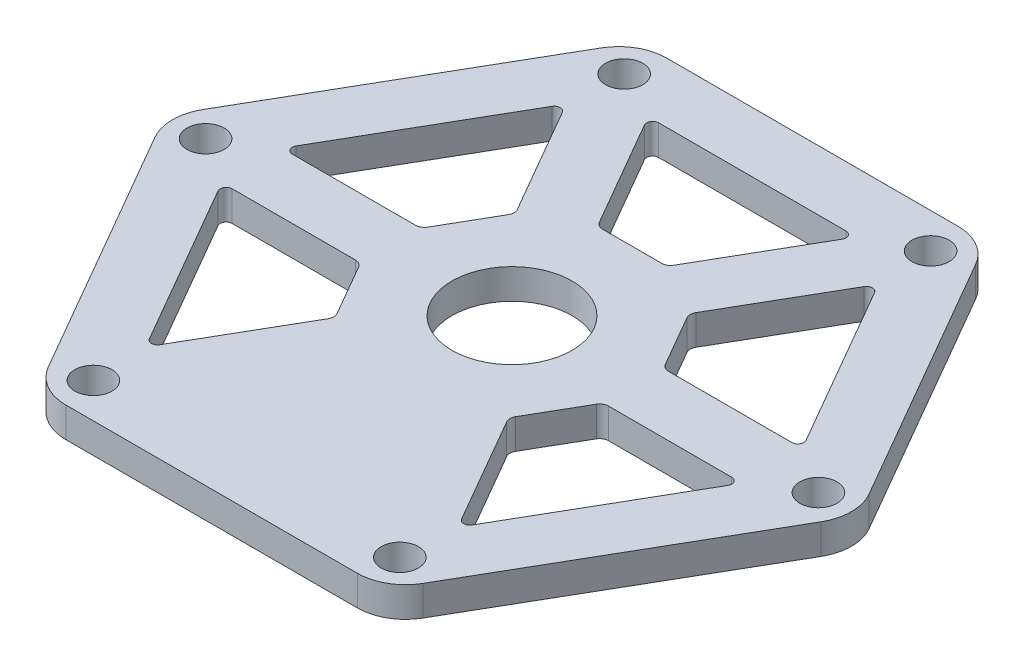
from build123d import *

# Parameters (mm, degrees)
BOSS_EXTRUDE1_DEPTH = 5
FILLET1_R           = 8
SKETCH2_R           = 10
SKETCH2_R_2         = 3.1
CUT_EXTRUDE1_DEPTH  = 10


with BuildPart() as part:
    # Sketch1 → Boss-Extrude1 (new body)
    with BuildSketch(Plane(origin=(0, 0, 0), x_dir=(1, 0, 0), z_dir=(0, 1, 0))):
        Polygon((-57.735026919, 0), (-28.867513459, -50), (28.867513459, -50), (57.735026919, 0), (28.867513459, 50), (-28.867513459, 50), align=None)
    extrude(amount=BOSS_EXTRUDE1_DEPTH)

    # Fillet1
    fillet1_edges = [part.edges().sort_by_distance(p)[0] for p in [
        (28.867513459, 2.5, -50),
        (57.735026919, 2.5, 0),
        (28.867513459, 2.5, 50),
        (-28.867513459, 2.5, 50),
        (-57.735026919, 2.5, 0),
        (-28.867513459, 2.5, -50),
    ]]
    fillet(fillet1_edges, radius=FILLET1_R)

    # Sketch2 → Cut-Extrude1 (cut)
    with BuildSketch(Plane(origin=(0, 5, 0), x_dir=(1, 0, 0), z_dir=(0, 1, 0))):
        Circle(SKETCH2_R)
        with Locations((-25.5, 44.167295593)):
            Circle(SKETCH2_R_2)
        with Locations((25.5, 44.167295593)):
            Circle(SKETCH2_R_2)
        with Locations((51, 0)):
            Circle(SKETCH2_R_2)
        with Locations((25.5, -44.167295593)):
            Circle(SKETCH2_R_2)
        with Locations((-25.5, -44.167295593)):
            Circle(SKETCH2_R_2)
        with Locations((-51, 0)):
            Circle(SKETCH2_R_2)
        with BuildLine():
            Line((6.206515394, 20.75), (16.454482672, 38.5))
            ThreePointArc((16.454482672, 38.5), (16.454482672, 39.5), (15.588457268, 40))
            Line((15.588457268, 40), (-15.588457268, 40))
            ThreePointArc((-15.588457268, 40), (-16.454482672, 39.5), (-16.454482672, 38.5))
            Line((-16.454482672, 38.5), (-6.206515394, 20.75))
            ThreePointArc((-6.206515394, 20.75), (-5.657477288, 20.200961894), (-4.907477288, 20))
            Line((-4.907477288, 20), (4.907477288, 20))
            ThreePointArc((4.907477288, 20), (5.657477288, 20.200961894), (6.206515394, 20.75))
        make_face()
        with BuildLine():
            Line((21.073284825, 5), (41.569219382, 5))
            ThreePointArc((41.569219382, 5), (42.435244785, 5.5), (42.435244785, 6.5))
            Line((42.435244785, 6.5), (26.846787517, 33.5))
            ThreePointArc((26.846787517, 33.5), (25.980762114, 34), (25.11473671, 33.5))
            Line((25.11473671, 33.5), (14.866769432, 15.75))
            ThreePointArc((14.866769432, 15.75), (14.665807537, 15), (14.866769432, 14.25))
            Line((14.866769432, 14.25), (19.77424672, 5.75))
            ThreePointArc((19.77424672, 5.75), (20.323284825, 5.200961894), (21.073284825, 5))
        make_face()
        with BuildLine():
            Line((14.866769432, -15.75), (25.11473671, -33.5))
            ThreePointArc((25.11473671, -33.5), (25.980762114, -34), (26.846787517, -33.5))
            Line((26.846787517, -33.5), (42.435244785, -6.5))
            ThreePointArc((42.435244785, -6.5), (42.435244785, -5.5), (41.569219382, -5))
            Line((41.569219382, -5), (21.073284825, -5))
            ThreePointArc((21.073284825, -5), (20.323284825, -5.200961894), (19.77424672, -5.75))
            Line((19.77424672, -5.75), (14.866769432, -14.25))
            ThreePointArc((14.866769432, -14.25), (14.665807537, -15), (14.866769432, -15.75))
        make_face()
        with BuildLine():
            Line((-21.073284825, -5), (-41.569219382, -5))
            ThreePointArc((-41.569219382, -5), (-42.435244785, -5.5), (-42.435244785, -6.5))
            Line((-42.435244785, -6.5), (-26.846787517, -33.5))
            ThreePointArc((-26.846787517, -33.5), (-25.980762114, -34), (-25.11473671, -33.5))
            Line((-25.11473671, -33.5), (-14.866769432, -15.75))
            ThreePointArc((-14.866769432, -15.75), (-14.665807537, -15), (-14.866769432, -14.25))
            Line((-14.866769432, -14.25), (-19.77424672, -5.75))
            ThreePointArc((-19.77424672, -5.75), (-20.323284825, -5.200961894), (-21.073284825, -5))
        make_face()
        with BuildLine():
            Line((-14.866769432, 15.75), (-25.11473671, 33.5))
            ThreePointArc((-25.11473671, 33.5), (-25.980762114, 34), (-26.846787517, 33.5))
            Line((-26.846787517, 33.5), (-42.435244785, 6.5))
            ThreePointArc((-42.435244785, 6.5), (-42.435244785, 5.5), (-41.569219382, 5))
            Line((-41.569219382, 5), (-21.073284825, 5))
            ThreePointArc((-21.073284825, 5), (-20.323284825, 5.200961894), (-19.77424672, 5.75))
            Line((-19.77424672, 5.75), (-14.866769432, 14.25))
            ThreePointArc((-14.866769432, 14.25), (-14.665807537, 15), (-14.866769432, 15.75))
        make_face()
    extrude(amount=-CUT_EXTRUDE1_DEPTH, mode=Mode.SUBTRACT)


solid = part.part
